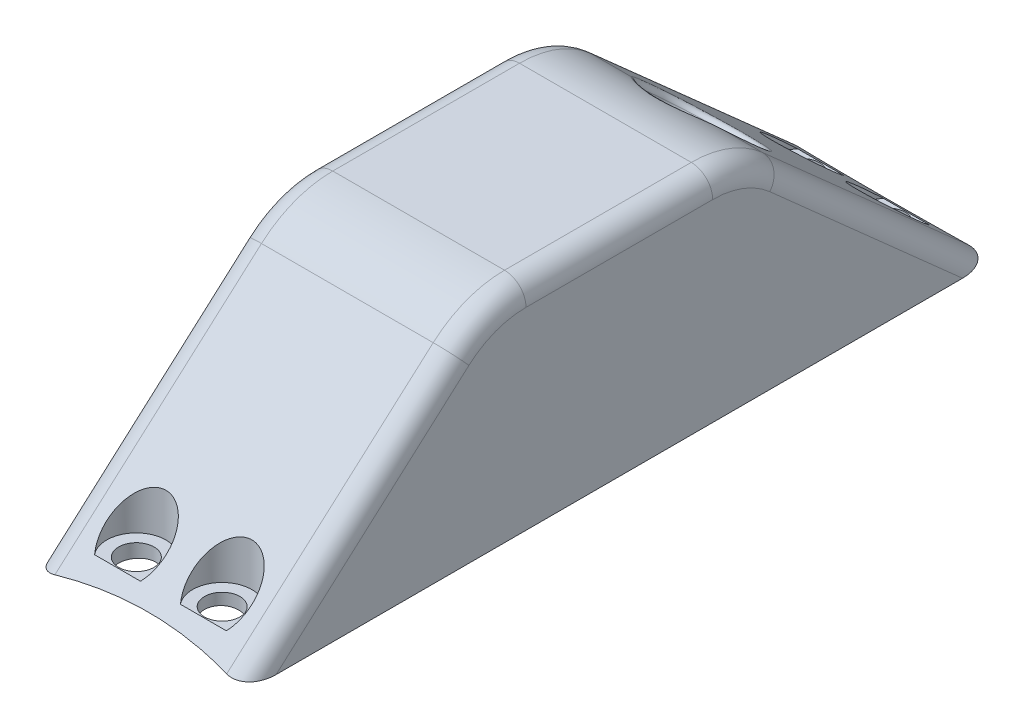
from build123d import *

# Parameters (mm, degrees)
BOSS_EXTRUDE1_DEPTH     = 20
FILLET1_R               = 2
SKETCH3_W               = 14.1
SKETCH3_H               = 19.5
CUT_EXTRUDE1_DEPTH      = 34
SKETCH4_R               = 4.75
CUT_EXTRUDE2_DEPTH      = 20
SKETCH4_5_W             = 11.9
SKETCH4_5_H             = 11.8
SKETCH4_5_R             = 4.75
CUT_EXTRUDE3_DEPTH      = 11
SKETCH4_6_W             = 14.1
SKETCH4_6_H             = 13
SKETCH4_6_W_2           = 11.9
SKETCH4_6_H_2           = 11.8
CUT_EXTRUDE4_DEPTH      = 5.6
SKETCH4_8_W             = 14.1
SKETCH4_8_H             = 17.2
CUT_EXTRUDE5_DEPTH      = 2.4
FILLET2_R               = 0.5
SKETCH7_R               = 1.65
CUT_EXTRUDE7_DEPTH      = 15
SKETCH7_3_R             = 2.765
SKETCH7_3_R_2           = 1.65
CUT_EXTRUDE8_DEPTH      = 8
CUT_EXTRUDE9_DEPTH      = 41
CUT_EXTRUDE9_DEPTH_BACK = 49
SKETCH8_R               = 51


with BuildPart() as part:
    # Sketch2 → Boss-Extrude1 (new body)
    with BuildSketch(Plane(origin=(0, 0, 0), x_dir=(0, 0, -1), z_dir=(1, 0, 0))):
        with BuildLine():
            Line((-35, 0), (35, 0))
            Line((35, 0), (15.341645165, 17.474093187))
            ThreePointArc((15.341645165, 17.474093187), (12.251812352, 19.347217015), (8.698006777, 20))
            Line((8.698006777, 20), (-8.698006777, 20))
            ThreePointArc((-8.698006777, 20), (-12.251812352, 19.347217015), (-15.341645165, 17.474093187))
            Line((-15.341645165, 17.474093187), (-35, 0))
        make_face()
    extrude(amount=BOSS_EXTRUDE1_DEPTH)

    # Fillet1
    fillet1_edges = [part.edges().sort_by_distance(p)[0] for p in [
        (20, 8.737046593, -25.170822582),
        (20, 19.347217015, -12.251812352),
        (20, 8.737046593, 25.170822582),
        (20, 19.347217015, 12.251812352),
        (20, 20, 0),
        (0, 8.737046593, -25.170822582),
        (0, 19.347217015, -12.251812352),
        (0, 20, 0),
        (0, 19.347217015, 12.251812352),
        (0, 8.737046593, 25.170822582),
    ]]
    fillet(fillet1_edges, radius=FILLET1_R)

    # Sketch3 → Cut-Extrude1 (cut)
    with BuildSketch(Plane(origin=(0, -17.379310345, -19.551724138), x_dir=(-1, 0, 0), z_dir=(0, -0.6643638388299198, -0.7474093186836597))):
        with Locations((-10, 0.502734359)):
            Rectangle(SKETCH3_W, SKETCH3_H)
    extrude(amount=-CUT_EXTRUDE1_DEPTH, mode=Mode.SUBTRACT)

    # Sketch4 → Cut-Extrude2 (cut)
    with BuildSketch(Plane(origin=(0, 7.662989202, -6.811545957), x_dir=(1, 0, 0), z_dir=(0, -0.7474093186836597, 0.6643638388299198))):
        with Locations((10, -2.934326154)):
            Circle(SKETCH4_R)
    extrude(amount=-CUT_EXTRUDE2_DEPTH, mode=Mode.SUBTRACT)

    # Sketch4<5> → Cut-Extrude3 (cut)
    with BuildSketch(Plane(origin=(0, 7.662989202, -6.811545957), x_dir=(1, 0, 0), z_dir=(0, -0.7474093186836597, 0.6643638388299198))):
        with Locations((10, -2.934326154)):
            Rectangle(SKETCH4_5_W, SKETCH4_5_H)
        with Locations((10, -2.934326154)):
            Circle(SKETCH4_5_R, mode=Mode.SUBTRACT)
    extrude(amount=-CUT_EXTRUDE3_DEPTH, mode=Mode.SUBTRACT)

    # Sketch4<6> → Cut-Extrude4 (cut)
    with BuildSketch(Plane(origin=(0, 7.662989202, -6.811545957), x_dir=(1, 0, 0), z_dir=(0, -0.7474093186836597, 0.6643638388299198))):
        with Locations((10, -2.934326154)):
            Rectangle(SKETCH4_6_W, SKETCH4_6_H)
        with Locations((10, -2.934326154)):
            Rectangle(SKETCH4_6_W_2, SKETCH4_6_H_2, mode=Mode.SUBTRACT)
    extrude(amount=-CUT_EXTRUDE4_DEPTH, mode=Mode.SUBTRACT)

    # Sketch4<8> → Cut-Extrude5 (cut)
    with BuildSketch(Plane(origin=(0, 7.662989202, -6.811545957), x_dir=(1, 0, 0), z_dir=(0, -0.7474093186836597, 0.6643638388299198))):
        with Locations((10, -2.934326154)):
            Rectangle(SKETCH4_8_W, SKETCH4_8_H)
    extrude(amount=-CUT_EXTRUDE5_DEPTH, mode=Mode.SUBTRACT)

    # Fillet2
    fillet2_edges = [part.edges().sort_by_distance(p)[0] for p in [
        (8.360804706, 12.46798392, -20.97351809),
        (10, 18.480237925, -13.997588339),
    ]]
    fillet(fillet2_edges, radius=FILLET2_R)

    # Sketch7 → Cut-Extrude7 (cut)
    with BuildSketch(Plane(origin=(0, 10, 0), x_dir=(1, 0, 0), z_dir=(0, 1, 0))):
        with Locations((14, 31)):
            Circle(SKETCH7_R)
        with Locations((6, 31)):
            Circle(SKETCH7_R)
        with Locations((14, -31)):
            Circle(SKETCH7_R)
        with Locations((6, -31)):
            Circle(SKETCH7_R)
    extrude(amount=-CUT_EXTRUDE7_DEPTH, mode=Mode.SUBTRACT)

    # Sketch7<3> → Cut-Extrude8 (cut)
    # profile 1 of 4: a face of its own
    with BuildSketch(Plane(origin=(0, 10, 0), x_dir=(1, 0, 0), z_dir=(0, 1, 0))):
        with Locations((6, 31)):
            Circle(SKETCH7_3_R)
    # profile 2 of 4: a face of its own
    with BuildSketch(Plane(origin=(0, 10, 0), x_dir=(1, 0, 0), z_dir=(0, 1, 0))):
        with Locations((14, 31)):
            Circle(SKETCH7_3_R)
        with Locations((14, 31)):
            Circle(SKETCH7_3_R_2, mode=Mode.SUBTRACT)
    # profile 3 of 4: a face of its own
    with BuildSketch(Plane(origin=(0, 10, 0), x_dir=(1, 0, 0), z_dir=(0, 1, 0))):
        with Locations((6, -31)):
            Circle(SKETCH7_3_R)
        with Locations((6, -31)):
            Circle(SKETCH7_3_R_2, mode=Mode.SUBTRACT)
    # profile 4 of 4: a face of its own
    with BuildSketch(Plane(origin=(0, 10, 0), x_dir=(1, 0, 0), z_dir=(0, 1, 0))):
        with Locations((14, -31)):
            Circle(SKETCH7_3_R)
        with Locations((14, -31)):
            Circle(SKETCH7_3_R_2, mode=Mode.SUBTRACT)
    extrude(amount=-CUT_EXTRUDE8_DEPTH, mode=Mode.SUBTRACT)

    # Sketch8 → Cut-Extrude9 (cut, two sides: drawn at the far end of the back side and taken through both)
    with BuildSketch(Plane.XY.offset(-CUT_EXTRUDE9_DEPTH_BACK)):
        with Locations((10.005755557, -50)):
            Circle(SKETCH8_R)
    extrude(amount=CUT_EXTRUDE9_DEPTH + CUT_EXTRUDE9_DEPTH_BACK, mode=Mode.SUBTRACT)


solid = part.part
